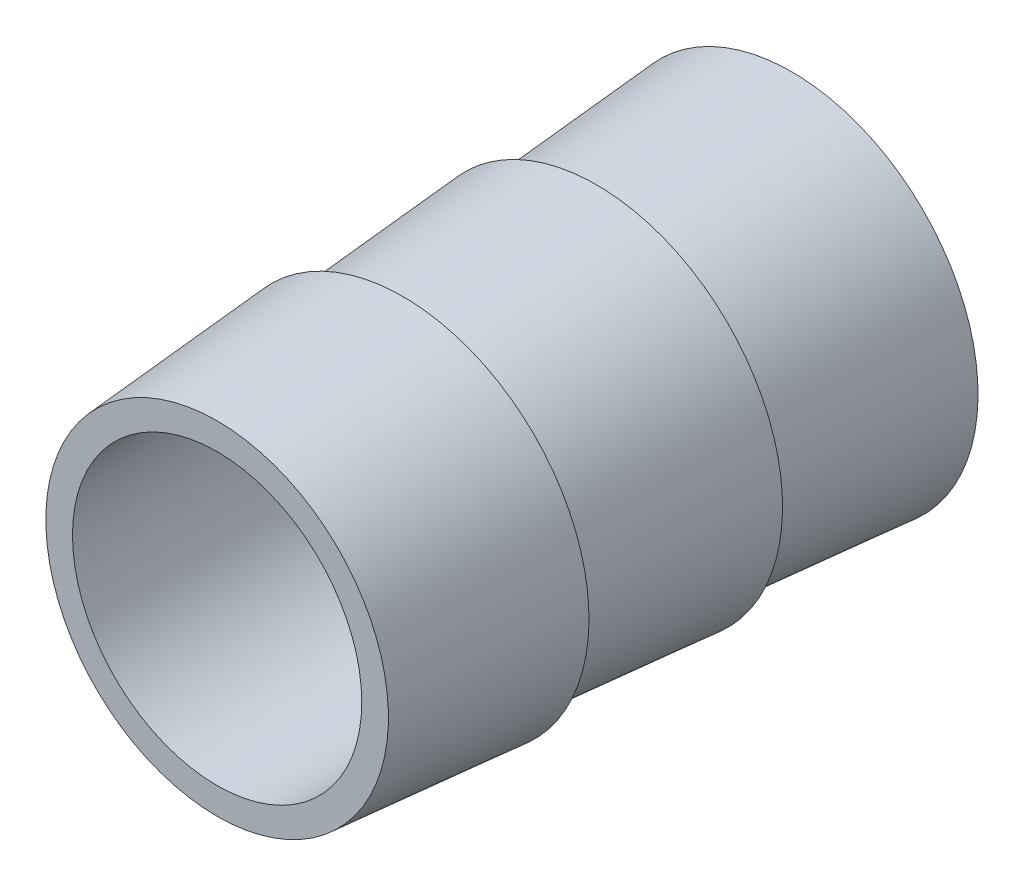
from build123d import *

# Parameters (mm, degrees)
SKETCH7_R          = 2.75
CUT_EXTRUDE3_DEPTH = 13.452424096


with BuildPart() as part:
    # Sketch2 → Revolve2 (revolve)
    with BuildSketch(Plane(origin=(0, 0, 0), x_dir=(0, 0, -1), z_dir=(1, 0, 0))):
        Polygon((-4.074860971, -1.269840707), (-0.541748287, -1.269840707), (6.852262086, -1.269840707), (6.852262086, 1.269840707), (6.852262086, 2.269840707), (3.138076713, 1.975013223), (3.138076713, 2.267113223), (-0.541748287, 1.975013223), (-0.541748287, 2.267113223), (-4.074860971, 1.986659067), (-4.074860971, 0.975127372), align=None)
    revolve(axis=Axis((0, -1.269840707, 0.541748287), (0, 0, -1)))

    # Sketch7 → Cut-Extrude3 (cut, through all)
    with BuildSketch(Plane(origin=(0, 0, -6.852262086), x_dir=(-1, 0, 0), z_dir=(0, 0, -1))):
        with Locations((0, -1.269840707)):
            Circle(SKETCH7_R)
    extrude(amount=-CUT_EXTRUDE3_DEPTH, mode=Mode.SUBTRACT)


solid = part.part
